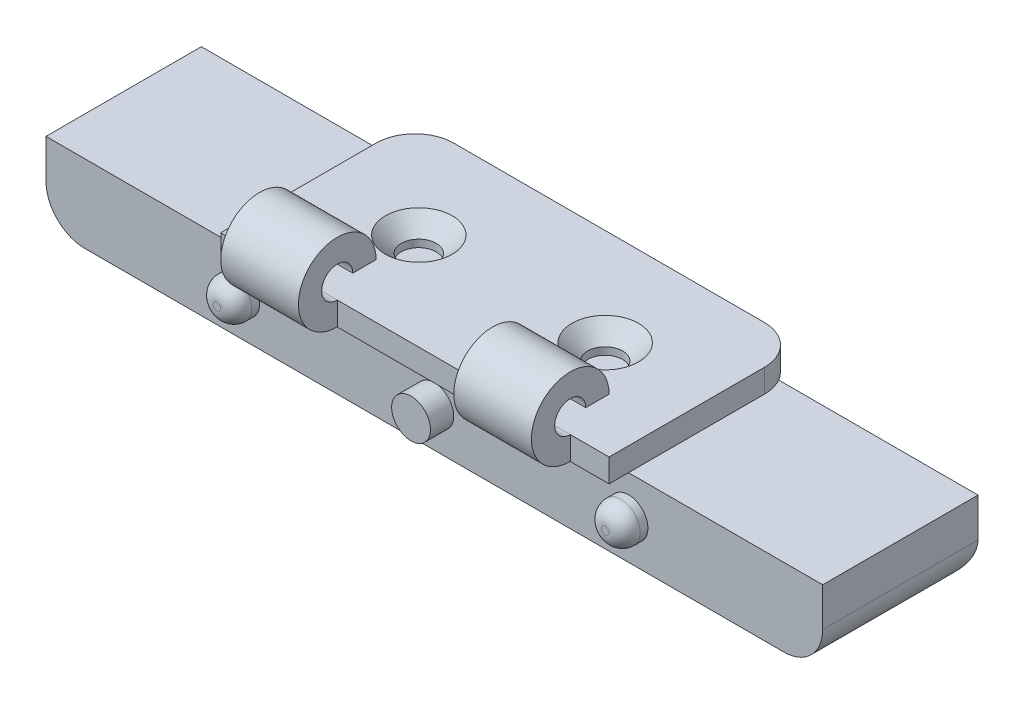
from build123d import *

# Parameters (mm, degrees)
SM_BASE_FLANGE_1_DEPTH   = 3
OTHER_START              = 10
OTHER_1_DEPTH            = 10
OTHER_START_2            = -20
OTHER_2_DEPTH            = 10
HOLE_WIZARD_1_AT_2_COUNT = 2
HOLE_WIZARD_1_AT_2_PITCH = 24
SKETCH_12_W              = 100
SKETCH_12_H              = 20
EXTRUDE_1_DEPTH          = 10
FILLET_1_R               = 5
SKETCH_13_R              = 2.5
EXTRUDE_2_DEPTH          = 3
FILLET_2_R               = 2


# Read off the part's stored shape, not the designer's step: 褶边1, 褶边2
# Sheet-metal steps are written as plain solids
with BuildPart() as part:
    # Sketch 1 → 基体-法兰1 (new body)
    with BuildSketch(Plane(origin=(0, 0, 0), x_dir=(1, 0, 0), z_dir=(0, 1, 0))):
        with BuildLine():
            Line((-25, -12.5), (25, -12.5))
            Line((25, -12.5), (25, 7.5))
            ThreePointArc((25, 7.5), (23.535533906, 11.035533906), (20, 12.5))
            Line((20, 12.5), (-20, 12.5))
            ThreePointArc((-20, 12.5), (-23.535533906, 11.035533906), (-25, 7.5))
            Line((-25, 7.5), (-25, -12.5))
        make_face()
    extrude(amount=-SM_BASE_FLANGE_1_DEPTH)

    # Other 1 outline → Other 1 (add)
    with BuildSketch(Plane.YZ.offset(OTHER_START)):
        with BuildLine():
            Line((2, 10.5), (2, 7.5))
            ThreePointArc((2, 7.5), (5.535533906, 16.035533906), (-3, 12.5))
            Line((-3, 12.5), (0, 12.5))
            ThreePointArc((0, 12.5), (3.414213562, 13.914213562), (2, 10.5))
        make_face()
    extrude(amount=OTHER_1_DEPTH)

    # Other 2 outline → Other 2 (add)
    with BuildSketch(Plane.YZ.offset(OTHER_START_2)):
        with BuildLine():
            Line((2, 10.5), (2, 7.5))
            ThreePointArc((2, 7.5), (5.535533906, 16.035533906), (-3, 12.5))
            Line((-3, 12.5), (0, 12.5))
            ThreePointArc((0, 12.5), (3.414213562, 13.914213562), (2, 10.5))
        make_face()
    extrude(amount=OTHER_2_DEPTH)

    # 草图11 → 打孔尺寸(%根据十字)槽半沉头木螺钉的类型1 (revolve, cut)
    with BuildSketch(Plane(origin=(-12, 0, 0), x_dir=(0, 0, 1), z_dir=(1, 0, 0))):
        Polygon((0, 0), (0, 3), (2.25, 3), (2.25, 2.05), (4.3, 0), align=None)
    hole_wizard_1 = revolve(axis=Axis((-12, 6.35, 0), (0, -1, 0)), mode=Mode.SUBTRACT)

    # 打孔尺寸(%根据十字)槽半沉头木螺钉的类型1 at 2: 打孔尺寸(%根据十字)槽半沉头木螺钉的类型1 ×2
    with Locations(*[(i * HOLE_WIZARD_1_AT_2_PITCH, 0, 0) for i in range(1, HOLE_WIZARD_1_AT_2_COUNT)]):
        add(hole_wizard_1, mode=Mode.SUBTRACT)

    # 草图12 → 凸台-拉伸1 (add)
    with BuildSketch(Plane(origin=(0, -3, 0), x_dir=(1, 0, 0), z_dir=(0, 1, 0))):
        Rectangle(SKETCH_12_W, SKETCH_12_H)
    extrude(amount=-EXTRUDE_1_DEPTH)

    # 圆角1
    fillet_1_edges = [part.edges().sort_by_distance(p)[0] for p in [
        (50, -13, 0),
        (-50, -13, 0),
        (0, -13, -10),
    ]]
    fillet(fillet_1_edges, radius=FILLET_1_R)

    # 草图13 → 凸台-拉伸2 (add)
    with BuildSketch(Plane.XY.offset(10)):
        with Locations((-25, -7.95945711)):
            Circle(SKETCH_13_R)
        with Locations((0, -7.95945711)):
            Circle(SKETCH_13_R)
        with Locations((25, -7.95945711)):
            Circle(SKETCH_13_R)
    extrude(amount=EXTRUDE_2_DEPTH)

    # 圆角2
    fillet_2_edges = [part.edges().sort_by_distance(p)[0] for p in [
        (22.5, -7.95945711, 13),
        (-27.5, -7.95945711, 13),
    ]]
    fillet(fillet_2_edges, radius=FILLET_2_R)


solid = part.part
